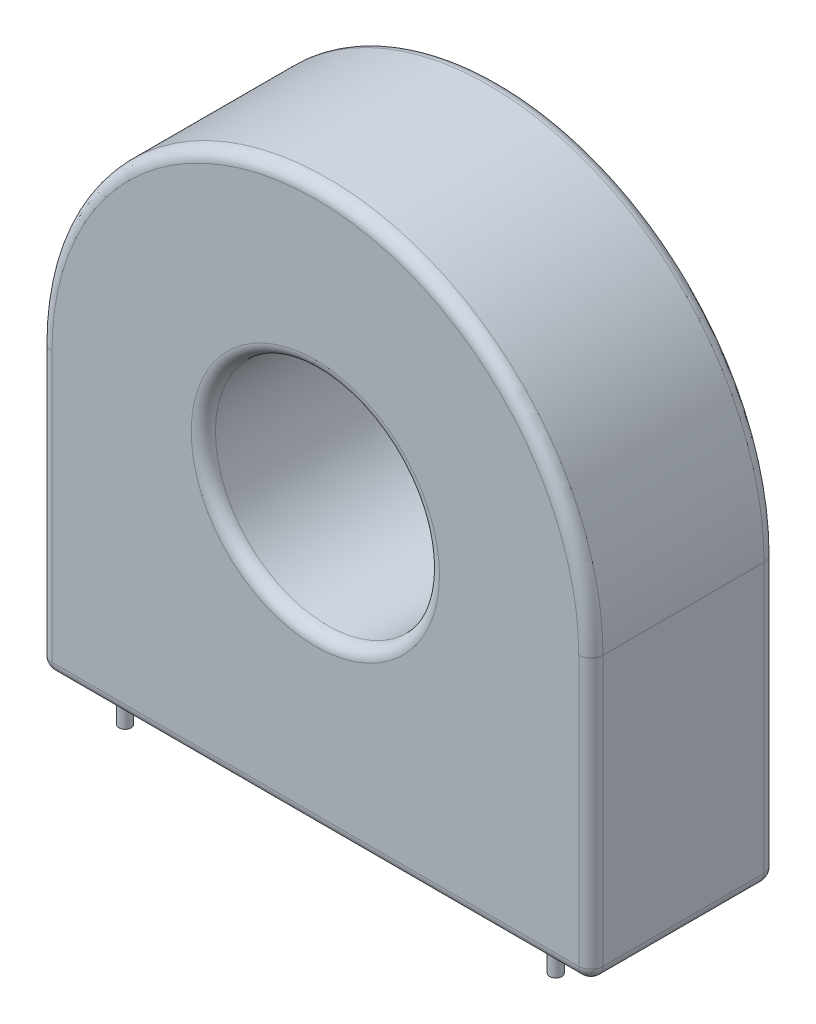
from build123d import *

# Parameters (mm, degrees)
SKETCH1_R           = 9.25
BOSS_EXTRUDE1_DEPTH = 7.65
SKETCH2_R           = 0.5
BOSS_EXTRUDE2_DEPTH = 2.5
FILLET1_R           = 1
SKETCH3_W           = 0.895944424
SKETCH3_H           = 4
SKETCH3_W_2         = 1.965215774
SKETCH3_H_2         = 0.500882695
CUT_EXTRUDE1_DEPTH  = 0.01
SKETCH4_W           = 0.682539037
SKETCH4_H           = 0.809522518
SKETCH4_H_2         = 0.809522517
CUT_EXTRUDE2_DEPTH  = 0.01


with BuildPart() as part:
    # Sketch1 → Boss-Extrude1 (new, symmetric)
    with BuildSketch(Plane.XY):
        with BuildLine():
            Line((-22.75, 11.625), (-22.75, -11.625))
            Line((-22.75, -11.625), (22.75, -11.625))
            Line((22.75, -11.625), (22.75, 11.625))
            ThreePointArc((22.75, 11.625), (0, 34.375), (-22.75, 11.625))
        make_face()
        with Locations((0, 11.625)):
            Circle(SKETCH1_R, mode=Mode.SUBTRACT)
    extrude(amount=BOSS_EXTRUDE1_DEPTH, both=True)

    # Sketch2 → Boss-Extrude2 (add, symmetric)
    with BuildSketch(Plane.XZ.offset(11.625)):
        with Locations((17.78, 5.58)):
            Circle(SKETCH2_R)
        with Locations((0, -4.58)):
            Circle(SKETCH2_R)
        with Locations((-17.78, 5.58)):
            Circle(SKETCH2_R)
    extrude(amount=BOSS_EXTRUDE2_DEPTH, both=True)

    # Fillet1
    fillet1_edges = [part.edges().sort_by_distance(p)[0] for p in [
        (-22.75, 0, -7.65),
        (0, 34.375, -7.65),
        (22.75, 0, 7.65),
        (-22.75, 0, 7.65),
        (-22.75, -11.625, 0),
        (22.75, -11.625, 0),
        (0, -11.625, -7.65),
        (0, -11.625, 7.65),
        (22.75, 0, -7.65),
        (0, 34.375, 7.65),
        (-9.25, 11.625, 7.65),
    ]]
    fillet(fillet1_edges, radius=FILLET1_R)

    # Sketch3 → Cut-Extrude1 (cut)
    # profile 1 of 17: a face of its own
    with BuildSketch(Plane.XY.offset(-7.65)):
        Polygon((-8.243385382, -3.852442817), (-9.139329806, -3.852442817), (-9.139329806, -0.943216627), (-11.623966601, -3.852442817), (-12.582009721, -3.852442817), (-12.582009721, 0.147557183), (-11.686065297, 0.147557183), (-11.686065297, -2.761482996), (-9.201445726, 0.147557183), (-8.243385382, 0.147557183), align=None)
    # profile 2 of 17: a face of its own
    with BuildSketch(Plane.XY.offset(-7.65)):
        with Locations((-7.393297629, -1.852442817)):
            Rectangle(SKETCH3_W, SKETCH3_H)
    # profile 3 of 17: a face of its own
    with BuildSketch(Plane.XY.offset(-7.65)):
        Polygon((-2.768958574, -3.852441956), (-6.834476962, -3.852441956), (-6.834476962, -3.351560122), (-3.664902998, -3.351560122), (-3.664902998, 0.147557183), (-2.768958574, 0.147557183), align=None)
    # profile 4 of 17: a face of its own
    with BuildSketch(Plane.XY.offset(-7.65)):
        with Locations((-0.282186518, -1.852442817)):
            Rectangle(SKETCH3_W, SKETCH3_H)
    # profile 5 of 17: a face of its own
    with BuildSketch(Plane.XY.offset(-7.65)):
        Polygon((5.244161293, -3.852442817), (4.329861111, -3.852442817), (3.769090333, -2.723695022), (1.66010458, -2.723695022), (1.099333802, -3.852442817), (0.18503362, -3.852442817), (2.19649402, 0.147557183), (3.232700893, 0.147557183), align=None)
        Polygon((3.506990947, -2.222812327), (2.714597456, -0.642503409), (1.922203965, -2.222812327), align=None, mode=Mode.SUBTRACT)
    # profile 6 of 17: a face of its own
    with BuildSketch(Plane.XY.offset(-7.65)):
        Polygon((9.590829785, -3.852442817), (8.694885362, -3.852442817), (8.694885362, -1.877134176), (6.14814987, -1.877134176), (6.14814987, -3.852442817), (5.252205447, -3.852442817), (5.252205447, 0.147557183), (6.14814987, 0.147557183), (6.14814987, -1.37625148), (8.694885362, -1.37625148), (8.694885362, 0.147557183), (9.590829785, 0.147557183), align=None)
    # profile 7 of 17: a face of its own
    with BuildSketch(Plane.XY.offset(-7.65)):
        Polygon((14.532518498, -0.353325513), (12.582011443, -0.353325513), (12.582011443, -3.852442817), (11.686067881, -3.852442817), (11.686067881, -0.353325513), (9.735560826, -0.353325513), (9.735560826, 0.147557183), (14.532518498, 0.147557183), align=None)
    # profile 8 of 17: a face of its own
    with BuildSketch(Plane.XY.offset(-7.65)):
        with BuildLine():
            add(Edge.make_bspline(
                [(-14.092768959, -8.387409611), (-14.093682359, -8.416798847), (-14.095444674, -8.473502486), (-14.107040039, -8.555298605), (-14.125683506, -8.631229451), (-14.151024529, -8.701754478), (-14.183558361, -8.767078187), (-14.224942542, -8.825300742), (-14.271907298, -8.879214637), (-14.326767489, -8.926585214), (-14.38808482, -8.967933996), (-14.454750326, -9.004373318), (-14.52729125, -9.03541708), (-14.606060265, -9.059642085), (-14.69033939, -9.079109265), (-14.780196049, -9.093183874), (-14.875991171, -9.100984664), (-14.941667322, -9.101946627), (-14.975485009, -9.102441956)],
                knots=[0, 0, 0, 0, 1.091324182, 2.105602559, 3.061388645, 3.990302777, 4.883708783, 5.761913066, 6.63583257, 7.533363956, 8.444729669, 9.377803759, 10.351071984, 11.369571165, 12.434066396, 13.5611468, 14.744196001, 16, 16, 16, 16], degree=3))
            Line((-14.975485009, -9.102441956), (-16.973509493, -9.102441956))
            add(Edge.make_bspline(
                [(-16.973509493, -9.102441956), (-17.007103675, -9.101941333), (-17.072556098, -9.100965956), (-17.168128459, -9.093184015), (-17.25798513, -9.079109231), (-17.342264241, -9.05964209), (-17.421033297, -9.03541709), (-17.493574078, -9.004373278), (-17.560240087, -8.96793414), (-17.621555608, -8.926584691), (-17.676422367, -8.879216537), (-17.723363266, -8.825293838), (-17.76483693, -8.767104304), (-17.797071266, -8.701561929), (-17.823788355, -8.631435435), (-17.842083583, -8.555267841), (-17.853747393, -8.473757651), (-17.855521593, -8.417298834), (-17.85643739, -8.388156242)],
                knots=[0, 0, 0, 0, 1.248585623, 2.432652029, 3.560701514, 4.626112014, 5.645486916, 6.619591972, 7.553468334, 8.465617653, 9.36392075, 10.238591664, 11.11755104, 12.011725211, 12.945218025, 13.90182591, 14.916976379, 16, 16, 16, 16], degree=3))
            Line((-17.85643739, -8.388156242), (-17.856440834, -5.817603477))
            add(Edge.make_bspline(
                [(-17.856440834, -5.817603477), (-17.855523491, -5.788462915), (-17.853746238, -5.732006206), (-17.842083798, -5.650497895), (-17.8237883, -5.574330315), (-17.797071279, -5.504203818), (-17.764836926, -5.438661443), (-17.723363267, -5.380471908), (-17.676422367, -5.32654921), (-17.621555608, -5.279181056), (-17.560240087, -5.237831606), (-17.493574078, -5.201392469), (-17.421033297, -5.170348655), (-17.342264241, -5.146123665), (-17.257985128, -5.126656481), (-17.168128465, -5.112581873), (-17.072333344, -5.104781083), (-17.006657193, -5.10381912), (-16.972839506, -5.103323791)],
                knots=[0, 0, 0, 0, 1.082394717, 2.097023559, 3.053139899, 3.986153045, 4.879867752, 5.758375482, 6.632596953, 7.530438465, 8.442119083, 9.37551558, 10.3491201, 11.367971205, 12.432834253, 13.560304098, 14.743762081, 16, 16, 16, 16], degree=3))
            Line((-16.972839506, -5.103323791), (-14.975689966, -5.102442817))
            add(Edge.make_bspline(
                [(-14.975689966, -5.102442817), (-14.941806362, -5.10331105), (-14.876074911, -5.104995352), (-14.780194387, -5.11252725), (-14.690339799, -5.126669955), (-14.606060162, -5.146120303), (-14.527291275, -5.170349507), (-14.45475032, -5.201392218), (-14.388084821, -5.237831805), (-14.326767488, -5.279180519), (-14.271907299, -5.326551114), (-14.22494254, -5.380465004), (-14.183558371, -5.43868756), (-14.151024493, -5.504011269), (-14.12568365, -5.574536294), (-14.107039472, -5.65046715), (-14.095481961, -5.73201659), (-14.093692588, -5.788469804), (-14.092768959, -5.817609505)],
                knots=[0, 0, 0, 0, 1.259172173, 2.442692089, 3.570220939, 4.635139714, 5.654044138, 6.627699609, 7.561144954, 8.472873283, 9.370761781, 10.245029003, 11.123582708, 12.017344185, 12.946627916, 13.902794293, 14.917476233, 16, 16, 16, 16], degree=3))
            Line((-14.092768959, -5.817609505), (-14.092768959, -8.387409611))
        make_face()
        with BuildLine():
            Line((-14.921694844, -8.418002541), (-14.921694844, -5.787010546))
            add(Edge.make_bspline(
                [(-14.921694844, -5.787010546), (-14.922552419, -5.772712006), (-14.924186458, -5.745467314), (-14.936173859, -5.707682312), (-14.953640843, -5.675085245), (-14.978500578, -5.648802462), (-15.009079361, -5.628002708), (-15.046310566, -5.614310691), (-15.089384151, -5.605145539), (-15.120343035, -5.604532632), (-15.13686067, -5.604205625)],
                knots=[0, 0, 0, 0, 1.068687892, 2.03629688, 2.942648866, 3.814683618, 4.718091592, 5.68670121, 6.765775135, 8, 8, 8, 8], degree=3))
            Line((-15.13686067, -5.604205625), (-16.811524126, -5.603325513))
            add(Edge.make_bspline(
                [(-16.811524126, -5.603325513), (-16.82802163, -5.604015565), (-16.858944314, -5.60530899), (-16.902236935, -5.614455591), (-16.939920748, -5.627778683), (-16.970720504, -5.648813863), (-16.995487187, -5.675102237), (-17.013313351, -5.707522083), (-17.023699745, -5.7458961), (-17.02619132, -5.773161473), (-17.027513228, -5.787627142)],
                knots=[0, 0, 0, 0, 1.229193561, 2.303982665, 3.289199236, 4.189019928, 5.057591977, 5.960344992, 6.917859159, 8, 8, 8, 8], degree=3))
            Line((-17.027513228, -5.787627142), (-17.02751495, -8.418002541))
            add(Edge.make_bspline(
                [(-17.02751495, -8.418002541), (-17.02619583, -8.432514035), (-17.023713126, -8.459826005), (-17.01331298, -8.498243414), (-16.995487323, -8.530664262), (-16.970720311, -8.556949177), (-16.939921439, -8.577998001), (-16.902234004, -8.591263307), (-16.858955334, -8.600660893), (-16.827986688, -8.60124727), (-16.811463845, -8.601560122)],
                knots=[0, 0, 0, 0, 1.085029602, 2.042125889, 2.944484921, 3.812677906, 4.712105896, 5.696892497, 6.771212539, 8, 8, 8, 8], degree=3))
            Line((-16.811463845, -8.601560122), (-15.137675333, -8.601560122))
            add(Edge.make_bspline(
                [(-15.137675333, -8.601560122), (-15.120884586, -8.601250355), (-15.089651388, -8.600674144), (-15.046310398, -8.591455672), (-15.009079392, -8.577762891), (-14.978500598, -8.55696333), (-14.953640732, -8.530680458), (-14.936174313, -8.498083577), (-14.924122164, -8.460101229), (-14.922532857, -8.432645352), (-14.921694844, -8.418002541)],
                knots=[0, 0, 0, 0, 1.248967675, 2.323258931, 3.287575479, 4.186979369, 5.05514909, 5.957483945, 6.920804297, 8, 8, 8, 8], degree=3))
        make_face(mode=Mode.SUBTRACT)
    # profile 9 of 17: a face of its own
    with BuildSketch(Plane.XY.offset(-7.65)):
        with BuildLine():
            add(Edge.make_bspline(
                [(-10.091358025, -8.387409611), (-10.092271424, -8.416798847), (-10.094033739, -8.473502486), (-10.105629104, -8.555298605), (-10.124272571, -8.631229451), (-10.149613594, -8.701754478), (-10.182147427, -8.767078187), (-10.223531608, -8.825300742), (-10.270496363, -8.879214637), (-10.325356554, -8.926585214), (-10.386673885, -8.967933996), (-10.453339391, -9.004373318), (-10.525880315, -9.03541708), (-10.60464933, -9.059642085), (-10.688928455, -9.079109265), (-10.778785114, -9.093183874), (-10.874580236, -9.100984664), (-10.940256387, -9.101946627), (-10.974074074, -9.102441956)],
                knots=[0, 0, 0, 0, 1.091324182, 2.105602559, 3.061388645, 3.990302777, 4.883708783, 5.761913066, 6.63583257, 7.533363956, 8.444729669, 9.377803759, 10.351071984, 11.369571165, 12.434066396, 13.5611468, 14.744196001, 16, 16, 16, 16], degree=3))
            Line((-10.974074074, -9.102441956), (-12.972098559, -9.102441956))
            add(Edge.make_bspline(
                [(-12.972098559, -9.102441956), (-13.00569274, -9.101941333), (-13.071145163, -9.100965956), (-13.166717524, -9.093184015), (-13.256574195, -9.079109231), (-13.340853306, -9.05964209), (-13.419622363, -9.03541709), (-13.492163143, -9.004373278), (-13.558829153, -8.96793414), (-13.620144673, -8.926584691), (-13.675011432, -8.879216537), (-13.721952331, -8.825293838), (-13.763425995, -8.767104304), (-13.795660331, -8.701561929), (-13.82237742, -8.631435435), (-13.840672649, -8.555267841), (-13.852336458, -8.473757651), (-13.854110658, -8.417298834), (-13.855026455, -8.388156242)],
                knots=[0, 0, 0, 0, 1.248585623, 2.432652029, 3.560701514, 4.626112014, 5.645486916, 6.619591972, 7.553468334, 8.465617653, 9.36392075, 10.238591664, 11.11755104, 12.011725211, 12.945218025, 13.90182591, 14.916976379, 16, 16, 16, 16], degree=3))
            Line((-13.855026455, -8.388156242), (-13.8550299, -5.817603477))
            add(Edge.make_bspline(
                [(-13.8550299, -5.817603477), (-13.854112557, -5.788462915), (-13.852335303, -5.732006206), (-13.840672863, -5.650497895), (-13.822377366, -5.574330315), (-13.795660345, -5.504203818), (-13.763425991, -5.438661443), (-13.721952332, -5.380471908), (-13.675011432, -5.32654921), (-13.620144673, -5.279181056), (-13.558829153, -5.237831606), (-13.492163143, -5.201392469), (-13.419622363, -5.170348655), (-13.340853307, -5.146123665), (-13.256574193, -5.126656481), (-13.16671753, -5.112581873), (-13.070922409, -5.104781083), (-13.005246258, -5.10381912), (-12.971428571, -5.103323791)],
                knots=[0, 0, 0, 0, 1.082394717, 2.097023559, 3.053139899, 3.986153045, 4.879867752, 5.758375482, 6.632596953, 7.530438465, 8.442119083, 9.37551558, 10.3491201, 11.367971205, 12.432834253, 13.560304098, 14.743762081, 16, 16, 16, 16], degree=3))
            Line((-12.971428571, -5.103323791), (-10.974279032, -5.102442817))
            add(Edge.make_bspline(
                [(-10.974279032, -5.102442817), (-10.940395427, -5.10331105), (-10.874663976, -5.104995352), (-10.778783452, -5.11252725), (-10.688928865, -5.126669955), (-10.604649228, -5.146120303), (-10.52588034, -5.170349507), (-10.453339385, -5.201392218), (-10.386673887, -5.237831805), (-10.325356553, -5.279180519), (-10.270496364, -5.326551114), (-10.223531605, -5.380465004), (-10.182147436, -5.43868756), (-10.149613558, -5.504011269), (-10.124272715, -5.574536294), (-10.105628537, -5.65046715), (-10.094071026, -5.73201659), (-10.092281653, -5.788469804), (-10.091358025, -5.817609505)],
                knots=[0, 0, 0, 0, 1.259172173, 2.442692089, 3.570220939, 4.635139714, 5.654044138, 6.627699609, 7.561144954, 8.472873283, 9.370761781, 10.245029003, 11.123582708, 12.017344185, 12.946627916, 13.902794293, 14.917476233, 16, 16, 16, 16], degree=3))
            Line((-10.091358025, -5.817609505), (-10.091358025, -8.387409611))
        make_face()
        with BuildLine():
            Line((-10.920283909, -8.418002541), (-10.920283909, -5.787010546))
            add(Edge.make_bspline(
                [(-10.920283909, -5.787010546), (-10.921141484, -5.772712006), (-10.922775523, -5.745467314), (-10.934762925, -5.707682312), (-10.952229908, -5.675085245), (-10.977089643, -5.648802462), (-11.007668426, -5.628002708), (-11.044899632, -5.614310691), (-11.087973216, -5.605145539), (-11.1189321, -5.604532632), (-11.135449735, -5.604205625)],
                knots=[0, 0, 0, 0, 1.068687892, 2.03629688, 2.942648866, 3.814683618, 4.718091592, 5.68670121, 6.765775135, 8, 8, 8, 8], degree=3))
            Line((-11.135449735, -5.604205625), (-12.810113192, -5.603325513))
            add(Edge.make_bspline(
                [(-12.810113192, -5.603325513), (-12.826610696, -5.604015565), (-12.857533379, -5.60530899), (-12.900826, -5.614455591), (-12.938509813, -5.627778683), (-12.969309569, -5.648813863), (-12.994076253, -5.675102237), (-13.011902417, -5.707522083), (-13.02228881, -5.7458961), (-13.024780385, -5.773161473), (-13.026102293, -5.787627142)],
                knots=[0, 0, 0, 0, 1.229193561, 2.303982665, 3.289199236, 4.189019928, 5.057591977, 5.960344992, 6.917859159, 8, 8, 8, 8], degree=3))
            Line((-13.026102293, -5.787627142), (-13.026104015, -8.418002541))
            add(Edge.make_bspline(
                [(-13.026104015, -8.418002541), (-13.024784896, -8.432514035), (-13.022302191, -8.459826005), (-13.011902045, -8.498243414), (-12.994076389, -8.530664262), (-12.969309376, -8.556949177), (-12.938510504, -8.577998001), (-12.900823069, -8.591263307), (-12.857544399, -8.600660893), (-12.826575753, -8.60124727), (-12.81005291, -8.601560122)],
                knots=[0, 0, 0, 0, 1.085029602, 2.042125889, 2.944484921, 3.812677906, 4.712105896, 5.696892497, 6.771212539, 8, 8, 8, 8], degree=3))
            Line((-12.81005291, -8.601560122), (-11.136264399, -8.601560122))
            add(Edge.make_bspline(
                [(-11.136264399, -8.601560122), (-11.119473651, -8.601250355), (-11.088240453, -8.600674144), (-11.044899463, -8.591455672), (-11.007668457, -8.577762891), (-10.977089664, -8.55696333), (-10.952229797, -8.530680458), (-10.934763379, -8.498083577), (-10.922711229, -8.460101229), (-10.921121922, -8.432645352), (-10.920283909, -8.418002541)],
                knots=[0, 0, 0, 0, 1.248967675, 2.323258931, 3.287575479, 4.186979369, 5.05514909, 5.957483945, 6.920804297, 8, 8, 8, 8], degree=3))
        make_face(mode=Mode.SUBTRACT)
    # profile 10 of 17: a face of its own
    with BuildSketch(Plane.XY.offset(-7.65)):
        Polygon((-6.747720493, -5.603325513), (-7.839507034, -5.603325513), (-7.839507034, -9.102442817), (-8.668432919, -9.102442817), (-8.668432919, -5.102442817), (-6.747720493, -5.102442817), align=None)
    # profile 11 of 17: a face of its own
    with BuildSketch(Plane.XY.offset(-7.65)):
        with Locations((-4.929806858, -7.441066726)):
            Rectangle(SKETCH3_W_2, SKETCH3_H_2)
    # profile 12 of 17: a face of its own
    with BuildSketch(Plane.XY.offset(-7.65)):
        with BuildLine():
            Line((-0.062433862, -9.102441956), (-2.943174396, -9.102441956))
            add(Edge.make_bspline(
                [(-2.943174396, -9.102441956), (-2.976768578, -9.101941333), (-3.042221001, -9.100965956), (-3.13779336, -9.093184015), (-3.227650038, -9.079109233), (-3.311929126, -9.059642082), (-3.390698265, -9.03541712), (-3.463238756, -9.004373172), (-3.529905784, -8.967934513), (-3.59121764, -8.926583343), (-3.646097698, -8.879221432), (-3.692990291, -8.825276058), (-3.734798666, -8.766957424), (-3.766268277, -8.701062772), (-3.793842135, -8.630980299), (-3.811573222, -8.554628837), (-3.823449348, -8.472886893), (-3.82519911, -8.416420771), (-3.826102293, -8.387274408)],
                knots=[0, 0, 0, 0, 1.247794276, 2.431110226, 3.558444758, 4.623180007, 5.641908834, 6.615396507, 7.548680983, 8.460252186, 9.357985943, 10.232102494, 11.11050479, 12.013864952, 12.936550513, 13.903155723, 14.917662794, 16, 16, 16, 16], degree=3))
            Line((-3.826102293, -8.387274408), (-3.826105737, -7.342130352))
            add(Edge.make_bspline(
                [(-3.826105737, -7.342130352), (-3.825194362, -7.313042769), (-3.823427062, -7.25663736), (-3.811620081, -7.174927589), (-3.793616474, -7.098392458), (-3.76672072, -7.028017), (-3.734505794, -6.962470097), (-3.693027214, -6.904281387), (-3.646087186, -6.850359776), (-3.59122188, -6.802986296), (-3.529899461, -6.76165761), (-3.463260618, -6.725137721), (-3.390529258, -6.694379354), (-3.31210164, -6.668858204), (-3.227716144, -6.649313706), (-3.137655444, -6.636986831), (-3.042063706, -6.627305701), (-2.976335586, -6.626609714), (-2.942504409, -6.62625148)],
                knots=[0, 0, 0, 0, 1.079603584, 2.093521595, 3.059565557, 3.99192505, 4.885013636, 5.762905899, 6.636514906, 7.533727405, 8.444769315, 9.377511891, 10.350434321, 11.371899559, 12.436016582, 13.561057118, 14.74464218, 16, 16, 16, 16], degree=3))
            Line((-2.942504409, -6.62625148), (-0.891359747, -6.62625148))
            Line((-0.891359747, -6.62625148), (-0.891359747, -5.603325513))
            Line((-0.891359747, -5.603325513), (-3.605051257, -5.603325513))
            Line((-3.605051257, -5.603325513), (-3.605051257, -5.102442817))
            Line((-3.605051257, -5.102442817), (-0.062433862, -5.102442817))
            Line((-0.062433862, -5.102442817), (-0.062433862, -7.127134176))
            Line((-0.062433862, -7.127134176), (-2.781189029, -7.127134176))
            add(Edge.make_bspline(
                [(-2.781189029, -7.127134176), (-2.797679997, -7.127833524), (-2.82859041, -7.129144371), (-2.871963862, -7.138180282), (-2.909228473, -7.151811502), (-2.940980804, -7.171619732), (-2.964826556, -7.198943809), (-2.983041164, -7.231267482), (-2.993346074, -7.269724557), (-2.995849785, -7.29697756), (-2.997178131, -7.311436665)],
                knots=[0, 0, 0, 0, 1.228569347, 2.302811313, 3.287526345, 4.174798407, 5.059089855, 5.961383309, 6.918410039, 8, 8, 8, 8], degree=3))
            Line((-2.997178131, -7.311436665), (-2.997179853, -8.417253326))
            add(Edge.make_bspline(
                [(-2.997179853, -8.417253326), (-2.995852085, -8.431715422), (-2.993349562, -8.458972994), (-2.983029314, -8.497407893), (-2.964868248, -8.529812795), (-2.940719274, -8.556964482), (-2.909540764, -8.577956677), (-2.871912747, -8.591275855), (-2.828616048, -8.600657094), (-2.797650133, -8.601245948), (-2.781128748, -8.601560122)],
                knots=[0, 0, 0, 0, 1.080018298, 2.035574722, 2.936481959, 3.819414846, 4.717395756, 5.700597943, 6.773189523, 8, 8, 8, 8], degree=3))
            Line((-2.781128748, -8.601560122), (-0.062433862, -8.601560122))
            Line((-0.062433862, -8.601560122), (-0.062433862, -9.102441956))
        make_face()
    # profile 13 of 17: a face of its own
    with BuildSketch(Plane.XY.offset(-7.65)):
        with Locations((1.09770637, -7.441066726)):
            Rectangle(SKETCH3_W_2, SKETCH3_H_2)
    # profile 14 of 17: a face of its own
    with BuildSketch(Plane.XY.offset(-7.65)):
        with BuildLine():
            add(Edge.make_bspline(
                [(5.965079365, -8.386535527), (5.964178551, -8.415925924), (5.962440446, -8.4726342), (5.95063423, -8.554660449), (5.932548182, -8.630769718), (5.906361096, -8.701259807), (5.874585792, -8.766930613), (5.832868082, -8.825283111), (5.785951405, -8.87921949), (5.731077978, -8.926583878), (5.669764295, -8.967934365), (5.603097775, -9.004373214), (5.530557139, -9.03541711), (5.451788042, -9.059642076), (5.36750894, -9.079109267), (5.277652274, -9.093183873), (5.181857154, -9.100984664), (5.116181002, -9.101946627), (5.082363316, -9.102441956)],
                knots=[0, 0, 0, 0, 1.090546724, 2.104191533, 3.069975193, 3.988060192, 4.890652559, 5.768308273, 6.641681885, 7.538652629, 8.449449058, 9.381940305, 10.354600579, 11.372463556, 12.436293852, 13.562670226, 14.744980438, 16, 16, 16, 16], degree=3))
            Line((5.082363316, -9.102441956), (3.084338831, -9.102441956))
            add(Edge.make_bspline(
                [(3.084338831, -9.102441956), (3.050744649, -9.101941333), (2.985292226, -9.100965956), (2.889719867, -9.093184015), (2.79986319, -9.079109233), (2.715584102, -9.059642082), (2.636814963, -9.03541712), (2.564274471, -9.004373172), (2.497607443, -8.967934513), (2.436295588, -8.926583343), (2.38141553, -8.879221432), (2.334522937, -8.825276058), (2.292714561, -8.766957424), (2.261244951, -8.701062772), (2.233671092, -8.630980299), (2.215940006, -8.554628837), (2.204063879, -8.472886893), (2.202314117, -8.416420771), (2.201410935, -8.387274408)],
                knots=[0, 0, 0, 0, 1.247794276, 2.431110226, 3.558444758, 4.623180007, 5.641908834, 6.615396507, 7.548680983, 8.460252186, 9.357985943, 10.232102494, 11.11050479, 12.013864952, 12.936550513, 13.903155723, 14.917662794, 16, 16, 16, 16], degree=3))
            Line((2.201410935, -8.387274408), (2.20140749, -7.342130352))
            add(Edge.make_bspline(
                [(2.20140749, -7.342130352), (2.202318865, -7.313042769), (2.204086166, -7.25663736), (2.215893147, -7.174927589), (2.233896753, -7.098392458), (2.260792507, -7.028017), (2.293007433, -6.962470097), (2.334486014, -6.904281387), (2.381426042, -6.850359776), (2.436291347, -6.802986296), (2.497613766, -6.76165761), (2.564252609, -6.725137721), (2.636983969, -6.694379354), (2.715411588, -6.668858204), (2.799797083, -6.649313706), (2.889857784, -6.636986831), (2.985449521, -6.627305701), (3.051177641, -6.626609714), (3.085008818, -6.62625148)],
                knots=[0, 0, 0, 0, 1.079603584, 2.093521595, 3.059565557, 3.99192505, 4.885013636, 5.762905899, 6.636514906, 7.533727405, 8.444769315, 9.377511891, 10.350434321, 11.371899559, 12.436016582, 13.561057118, 14.74464218, 16, 16, 16, 16], degree=3))
            Line((3.085008818, -6.62625148), (5.13615348, -6.62625148))
            Line((5.13615348, -6.62625148), (5.13615348, -6.037295593))
            add(Edge.make_bspline(
                [(5.13615348, -6.037295593), (5.134669543, -6.003911441), (5.131863069, -5.940774166), (5.109887248, -5.851914284), (5.071662187, -5.775539215), (5.016131625, -5.713430919), (4.945922492, -5.664285665), (4.860067415, -5.630843446), (4.760163091, -5.608269116), (4.688325623, -5.60561293), (4.65026455, -5.604205625)],
                knots=[0, 0, 0, 0, 1.078341341, 2.039396853, 2.936100315, 3.811247336, 4.704924793, 5.680758394, 6.771214737, 8, 8, 8, 8], degree=3))
            Line((4.65026455, -5.604205625), (2.477723008, -5.603325513))
            Line((2.477723008, -5.603325513), (2.477723008, -5.102442817))
            Line((2.477723008, -5.102442817), (4.866177869, -5.102442817))
            add(Edge.make_bspline(
                [(4.866177869, -5.102442817), (4.908269619, -5.103563399), (4.990162799, -5.105743589), (5.109341208, -5.114696909), (5.221051232, -5.132427713), (5.325501701, -5.157485777), (5.423722659, -5.187375359), (5.513734389, -5.226680498), (5.597083234, -5.271836678), (5.672845167, -5.32471404), (5.741022297, -5.384413088), (5.800067642, -5.451821757), (5.851043602, -5.526016104), (5.890766339, -5.608882975), (5.924528279, -5.697668163), (5.946261716, -5.794495207), (5.962237991, -5.897924134), (5.964114467, -5.969511356), (5.965079365, -6.006322027)],
                knots=[0, 0, 0, 0, 1.248360097, 2.428793654, 3.540639795, 4.597573295, 5.611896563, 6.58001487, 7.504387576, 8.418265567, 9.313545441, 10.184224061, 11.068921664, 11.973149494, 12.902398245, 13.878991678, 14.90936207, 16, 16, 16, 16], degree=3))
            Line((5.965079365, -6.006322027), (5.965079365, -8.386535527))
        make_face()
        with BuildLine():
            Line((5.13615348, -8.417253326), (5.13615348, -7.127134176))
            Line((5.13615348, -7.127134176), (3.246324198, -7.127134176))
            add(Edge.make_bspline(
                [(3.246324198, -7.127134176), (3.229833231, -7.127833524), (3.198922817, -7.129144371), (3.155549365, -7.138180282), (3.118284754, -7.151811502), (3.086532423, -7.171619732), (3.062686671, -7.198943809), (3.044472063, -7.231267482), (3.034167153, -7.269724557), (3.031663443, -7.29697756), (3.030335097, -7.311436665)],
                knots=[0, 0, 0, 0, 1.228569347, 2.302811313, 3.287526345, 4.174798407, 5.059089855, 5.961383309, 6.918410039, 8, 8, 8, 8], degree=3))
            Line((3.030335097, -7.311436665), (3.030333375, -8.417253326))
            add(Edge.make_bspline(
                [(3.030333375, -8.417253326), (3.031661142, -8.431715422), (3.034163665, -8.458972994), (3.044483913, -8.497407893), (3.062644979, -8.529812795), (3.086793953, -8.556964482), (3.117972463, -8.577956677), (3.155600481, -8.591275855), (3.19889718, -8.600657094), (3.229863094, -8.601245948), (3.24638448, -8.601560122)],
                knots=[0, 0, 0, 0, 1.080018298, 2.035574722, 2.936481959, 3.819414846, 4.717395756, 5.700597943, 6.773189523, 8, 8, 8, 8], degree=3))
            Line((3.24638448, -8.601560122), (4.920172991, -8.601560122))
            add(Edge.make_bspline(
                [(4.920172991, -8.601560122), (4.936962248, -8.601249004), (4.968192673, -8.600670281), (5.011551634, -8.591468092), (5.048724441, -8.577722577), (5.079681832, -8.556979089), (5.103925391, -8.529829418), (5.12172559, -8.497248415), (5.133711047, -8.459205719), (5.135310243, -8.431758791), (5.13615348, -8.417253326)],
                knots=[0, 0, 0, 0, 1.246449489, 2.318574743, 3.280947022, 4.178537522, 5.061086541, 5.961602094, 6.922980187, 8, 8, 8, 8], degree=3))
        make_face(mode=Mode.SUBTRACT)
    # profile 15 of 17: a face of its own
    with BuildSketch(Plane.XY.offset(-7.65)):
        Polygon((9.988555101, -5.603325513), (7.149910094, -5.603325513), (9.060536541, -9.102442817), (8.132517981, -9.102442817), (6.253964809, -5.603325513), (6.253964809, -5.102442817), (9.988555101, -5.102442817), align=None)
    # profile 16 of 17: a face of its own
    with BuildSketch(Plane.XY.offset(-7.65)):
        Polygon((13.685714286, -9.102441956), (10.018143395, -9.102441956), (10.018143395, -8.601560122), (12.856788401, -8.601560122), (12.856788401, -5.102442817), (13.685714286, -5.102442817), align=None)
    # profile 17 of 17: a face of its own
    with BuildSketch(Plane.XY.offset(-7.65)):
        Polygon((18.07948547, -5.603325513), (16.332627005, -5.603325513), (16.332627005, -9.102442817), (15.50370112, -9.102442817), (15.50370112, -5.603325513), (13.756842655, -5.603325513), (13.756842655, -5.102442817), (18.07948547, -5.102442817), align=None)
    extrude(amount=CUT_EXTRUDE1_DEPTH, mode=Mode.SUBTRACT)

    # Sketch4 → Cut-Extrude2 (cut)
    # profile 1 of 6: a face of its own
    with BuildSketch(Plane.XZ.offset(11.625)):
        with BuildLine():
            Line((-17.977955234, 3.785665694), (-20.470002579, 3.785665694))
            Line((-20.470002579, 3.785665694), (-20.470002579, 3.410004318))
            Line((-20.470002579, 3.410004318), (-18.522911986, 3.410004318))
            Line((-18.522911986, 3.410004318), (-18.522911986, 2.442393641))
            add(Edge.make_bspline(
                [(-18.522911986, 2.442393641), (-18.523662632, 2.431330693), (-18.525062188, 2.410704172), (-18.532348559, 2.381898417), (-18.544234787, 2.357674062), (-18.560672003, 2.337919704), (-18.581005577, 2.322030697), (-18.606201681, 2.311858475), (-18.635197547, 2.304890863), (-18.656028186, 2.304429461), (-18.667100277, 2.304184213)],
                knots=[0, 0, 0, 0, 1.168383886, 2.178415151, 3.114761772, 3.990479347, 4.869897153, 5.80768764, 6.834722204, 8, 8, 8, 8], degree=3))
            Line((-18.667100277, 2.304184213), (-19.888988582, 2.304184858))
            add(Edge.make_bspline(
                [(-19.888988582, 2.304184858), (-19.911388772, 2.303913138), (-19.954860271, 2.303385817), (-20.017868855, 2.296194587), (-20.077248979, 2.286727695), (-20.132730361, 2.272402718), (-20.18416234, 2.252852298), (-20.232005362, 2.229664337), (-20.276380349, 2.20280682), (-20.316615169, 2.171332708), (-20.352362455, 2.135567208), (-20.38379617, 2.095465719), (-20.410571058, 2.050933071), (-20.431212773, 2.001442532), (-20.448927781, 1.948540897), (-20.460190982, 1.890950388), (-20.46870481, 1.829566741), (-20.469567241, 1.787021412), (-20.47001033, 1.765163048)],
                knots=[0, 0, 0, 0, 1.188285322, 2.306076078, 3.362203406, 4.378287727, 5.341092893, 6.277876351, 7.197026917, 8.088882973, 8.98250288, 9.874358936, 10.787456248, 11.730866857, 12.715190664, 13.743331781, 14.840599528, 16, 16, 16, 16], degree=3))
            Line((-20.47001033, 1.765163048), (-20.470002579, 1.32406811))
            add(Edge.make_bspline(
                [(-20.470002579, 1.32406811), (-20.469563353, 1.302195471), (-20.468708707, 1.259635704), (-20.460190504, 1.198238161), (-20.448927902, 1.140647625), (-20.431212736, 1.087746019), (-20.410571093, 1.03825539), (-20.383796072, 0.993723059), (-20.352362807, 0.953620423), (-20.316613856, 0.917859191), (-20.276385305, 0.886369006), (-20.23198608, 0.859573627), (-20.184305432, 0.836179537), (-20.132584144, 0.817582945), (-20.077191415, 0.803328368), (-20.017986612, 0.792551309), (-19.954915294, 0.786777017), (-19.911599716, 0.786043132), (-19.889322499, 0.785665694)],
                knots=[0, 0, 0, 0, 1.160756192, 2.258598661, 3.287278292, 4.272117663, 5.216022406, 6.129597976, 7.021921163, 7.916009126, 8.808332313, 9.727964308, 10.665238429, 11.624484024, 12.641100546, 13.699789761, 14.817001044, 16, 16, 16, 16], degree=3))
            Line((-19.889322499, 0.785665694), (-18.159607485, 0.78566634))
            Line((-18.159607485, 0.78566634), (-18.159607485, 1.161328361))
            Line((-18.159607485, 1.161328361), (-19.78114043, 1.161328361))
            add(Edge.make_bspline(
                [(-19.78114043, 1.161328361), (-19.792329157, 1.16158698), (-19.813268247, 1.16207097), (-19.842601797, 1.168805574), (-19.867455066, 1.179970144), (-19.887971087, 1.195674155), (-19.904367896, 1.215494681), (-19.916406758, 1.239882171), (-19.923409323, 1.268768003), (-19.924909214, 1.289376062), (-19.92569816, 1.300215959)],
                knots=[0, 0, 0, 0, 1.175204619, 2.199330993, 3.14391349, 4.020841102, 4.89407896, 5.827774186, 6.857403133, 8, 8, 8, 8], degree=3))
            Line((-19.92569816, 1.300215959), (-19.925045827, 1.789033285))
            add(Edge.make_bspline(
                [(-19.925045827, 1.789033285), (-19.924544547, 1.79986403), (-19.923589875, 1.820490854), (-19.916203781, 1.849438678), (-19.904578802, 1.874238348), (-19.887949436, 1.894166243), (-19.867461374, 1.909882565), (-19.842599843, 1.921043329), (-19.81339251, 1.927751612), (-19.792580471, 1.928255177), (-19.781518266, 1.928522837)],
                knots=[0, 0, 0, 0, 1.137900938, 2.16709752, 3.121197092, 3.994068258, 4.870627628, 5.814813473, 6.838509792, 8, 8, 8, 8], degree=3))
            Line((-19.781518266, 1.928522837), (-18.55886137, 1.928522837))
            add(Edge.make_bspline(
                [(-18.55886137, 1.928522837), (-18.536729182, 1.928904128), (-18.493558818, 1.929647862), (-18.430631937, 1.935408335), (-18.371427114, 1.946185534), (-18.316034444, 1.960440107), (-18.264312956, 1.979036591), (-18.216633021, 2.002431097), (-18.172231221, 2.029224965), (-18.132011979, 2.060720614), (-18.096228458, 2.096461554), (-18.06504139, 2.13649113), (-18.037839154, 2.180549483), (-18.017584813, 2.229788875), (-17.999551643, 2.282354593), (-17.988520085, 2.339570131), (-17.979863979, 2.400706371), (-17.979035868, 2.443037678), (-17.978608213, 2.464898498)],
                knots=[0, 0, 0, 0, 1.178342751, 2.298439003, 3.359862066, 4.379103791, 5.340826441, 6.280520881, 7.202527636, 8.097155065, 8.993551826, 9.888179255, 10.794055488, 11.740397672, 12.716623759, 13.747959744, 14.836996782, 16, 16, 16, 16], degree=3))
            Line((-17.978608213, 2.464898498), (-17.977955234, 3.785665694))
        make_face()
    # profile 2 of 6: a face of its own
    with BuildSketch(Plane.XZ.offset(11.625)):
        Polygon((-15.272495139, 3.023761578), (-15.781121441, 3.023761578), (-15.781121441, 3.78566634), (-16.241439547, 3.78566634), (-16.241439547, 3.023761578), (-16.923978584, 3.023761578), (-16.923978584, 3.78566634), (-17.384297336, 3.78566634), (-17.384297336, 3.023761578), (-17.892923638, 3.023761578), (-17.892923638, 2.690427599), (-17.384297336, 2.690427599), (-17.384297336, 1.880905081), (-17.892923638, 1.880905081), (-17.892923638, 1.547571102), (-17.384297336, 1.547571102), (-17.384297336, 0.78566634), (-16.923978584, 0.78566634), (-16.923978584, 1.547571102), (-16.241439547, 1.547571102), (-16.241439547, 0.78566634), (-15.781121441, 0.78566634), (-15.781121441, 1.547571102), (-15.272495139, 1.547571102), (-15.272495139, 1.880905081), (-15.781121441, 1.880905081), (-15.781121441, 2.690427599), (-15.272495139, 2.690427599), align=None)
        with Locations((-16.582709066, 2.28566634)):
            Rectangle(SKETCH4_W, SKETCH4_H, mode=Mode.SUBTRACT)
    # profile 3 of 6: a face of its own
    with BuildSketch(Plane.XZ.offset(11.625)):
        Polygon((14.998388573, 1.161328361), (14.27177957, 1.161328361), (14.27177957, 3.78566634), (13.726822818, 3.78566634), (13.726822818, 0.78566634), (14.998388573, 0.78566634), align=None)
    # profile 4 of 6: a face of its own
    with BuildSketch(Plane.XZ.offset(11.625)):
        Polygon((18.162425496, 3.023761578), (17.653799194, 3.023761578), (17.653799194, 3.78566634), (17.193481088, 3.78566634), (17.193481088, 3.023761578), (16.510942051, 3.023761578), (16.510942051, 3.78566634), (16.050623299, 3.78566634), (16.050623299, 3.023761578), (15.541996997, 3.023761578), (15.541996997, 2.690427599), (16.050623299, 2.690427599), (16.050623299, 1.880905081), (15.541996997, 1.880905081), (15.541996997, 1.547571102), (16.050623299, 1.547571102), (16.050623299, 0.78566634), (16.510942051, 0.78566634), (16.510942051, 1.547571102), (17.193481088, 1.547571102), (17.193481088, 0.78566634), (17.653799194, 0.78566634), (17.653799194, 1.547571102), (18.162425496, 1.547571102), (18.162425496, 1.880905081), (17.653799194, 1.880905081), (17.653799194, 2.690427599), (18.162425496, 2.690427599), align=None)
        with Locations((16.852211569, 2.28566634)):
            Rectangle(SKETCH4_W, SKETCH4_H, mode=Mode.SUBTRACT)
    # profile 5 of 6: a face of its own
    with BuildSketch(Plane.XZ.offset(11.625)):
        with BuildLine():
            Line((0.068470519, -0.379493213), (-1.784382439, -0.379493213))
            add(Edge.make_bspline(
                [(-1.784382439, -0.379493213), (-1.806873855, -0.379761618), (-1.85043672, -0.380281483), (-1.913535932, -0.38748279), (-1.972916046, -0.396949737), (-2.02839739, -0.411274726), (-2.079829521, -0.430825053), (-2.127671997, -0.454013362), (-2.172048953, -0.480869618), (-2.212276659, -0.512348289), (-2.248050363, -0.548096859), (-2.279268389, -0.58811271), (-2.306247453, -0.632046778), (-2.32700778, -0.681081577), (-2.34458205, -0.733819548), (-2.355797817, -0.791190557), (-2.364412714, -0.852341249), (-2.365246702, -0.894670495), (-2.365677392, -0.91653025)],
                knots=[0, 0, 0, 0, 1.195173015, 2.314890322, 3.372837922, 4.3906735, 5.355138094, 6.293536131, 7.214270886, 8.107664086, 9.002824179, 9.896217379, 10.800843866, 11.735133181, 12.721153505, 13.751066659, 14.838601261, 16, 16, 16, 16], degree=3))
            Line((-2.365677392, -0.91653025), (-2.365669641, -1.584535169))
            add(Edge.make_bspline(
                [(-2.365669641, -1.584535169), (-2.364187967, -1.617000533), (-2.361398272, -1.678126278), (-2.346527644, -1.764152666), (-2.321824118, -1.838558768), (-2.286798166, -1.901362163), (-2.244270892, -1.952987001), (-2.198476054, -1.997161407), (-2.148578988, -2.033770202), (-2.112016281, -2.051326722), (-2.093851995, -2.060048769)],
                knots=[0, 0, 0, 0, 1.338248567, 2.519652672, 3.585454005, 4.553382934, 5.464210136, 6.331599572, 7.171141735, 8, 8, 8, 8], degree=3))
            add(Edge.make_bspline(
                [(-2.093851995, -2.060048769), (-2.112009075, -2.068778563), (-2.148557278, -2.086350677), (-2.198689738, -2.122930761), (-2.244249093, -2.16783698), (-2.286830318, -2.22007597), (-2.321654842, -2.283389471), (-2.346749032, -2.358318841), (-2.361260678, -2.444872432), (-2.364152293, -2.506422124), (-2.365677392, -2.538884748)],
                knots=[0, 0, 0, 0, 0.824792689, 1.660216872, 2.529624704, 3.443034264, 4.414115552, 5.474689096, 6.668097019, 8, 8, 8, 8], degree=3))
            Line((-2.365677392, -2.538884748), (-2.365669641, -2.841090797))
            add(Edge.make_bspline(
                [(-2.365669641, -2.841090797), (-2.365230415, -2.862963436), (-2.364375769, -2.905523203), (-2.355857566, -2.966920747), (-2.344594964, -3.024511283), (-2.326879798, -3.077412888), (-2.306238155, -3.126903517), (-2.279463134, -3.171435849), (-2.248029869, -3.211538485), (-2.212280918, -3.247299716), (-2.172052367, -3.278789901), (-2.127653142, -3.30558528), (-2.079972494, -3.328979371), (-2.028251206, -3.347575962), (-1.972858477, -3.361830539), (-1.913653674, -3.372607599), (-1.850582356, -3.37838189), (-1.807266778, -3.379115776), (-1.784989561, -3.379493213)],
                knots=[0, 0, 0, 0, 1.160756192, 2.258598661, 3.287278292, 4.272117663, 5.216022406, 6.129597976, 7.021921163, 7.916009126, 8.808332313, 9.727964308, 10.665238429, 11.624484024, 12.641100546, 13.699789761, 14.817001044, 16, 16, 16, 16], degree=3))
            Line((-1.784989561, -3.379493213), (0.068470519, -3.379492567))
            Line((0.068470519, -3.379492567), (0.068470519, -3.003830546))
            Line((0.068470519, -3.003830546), (-1.675391088, -3.003830546))
            add(Edge.make_bspline(
                [(-1.675391088, -3.003830546), (-1.686607282, -3.003550515), (-1.707785748, -3.003021759), (-1.737404184, -2.996464844), (-1.762501321, -2.985216682), (-1.782944681, -2.969275144), (-1.800112372, -2.949912598), (-1.812031164, -2.925240521), (-1.819088906, -2.896401534), (-1.820580591, -2.875786509), (-1.821365222, -2.864942949)],
                knots=[0, 0, 0, 0, 1.172495619, 2.213911402, 3.153694288, 4.026166056, 4.909860763, 5.838811697, 6.863208895, 8, 8, 8, 8], degree=3))
            Line((-1.821365222, -2.864942949), (-1.820712889, -2.376125623))
            add(Edge.make_bspline(
                [(-1.820712889, -2.376125623), (-1.820215882, -2.365291241), (-1.819269347, -2.344657492), (-1.811828012, -2.315756678), (-1.800328709, -2.290668301), (-1.782923228, -2.271202035), (-1.762507523, -2.255248522), (-1.737402214, -2.244004022), (-1.707940836, -2.237479452), (-1.686920914, -2.236926809), (-1.675862577, -2.23663607)],
                knots=[0, 0, 0, 0, 1.132583134, 2.156969924, 3.10661066, 3.99029639, 4.862759295, 5.802532633, 6.843937837, 8, 8, 8, 8], degree=3))
            Line((-1.675862577, -2.23663607), (-0.258503533, -2.23663607))
            Line((-0.258503533, -2.23663607), (-0.258503533, -1.860974049))
            Line((-0.258503533, -1.860974049), (-1.675391088, -1.860974049))
            add(Edge.make_bspline(
                [(-1.675391088, -1.860974049), (-1.686617569, -1.860716696), (-1.707815447, -1.860230761), (-1.737216907, -1.853406443), (-1.76265845, -1.843155087), (-1.782919736, -1.827028737), (-1.80012835, -1.807733409), (-1.811896286, -1.783225191), (-1.819179522, -1.754673663), (-1.820606687, -1.734258937), (-1.821365222, -1.723408557)],
                knots=[0, 0, 0, 0, 1.177167623, 2.222731914, 3.156821517, 4.032768801, 4.919983729, 5.852635165, 6.858680457, 8, 8, 8, 8], degree=3))
            Line((-1.821365222, -1.723408557), (-1.820712889, -0.893384686))
            add(Edge.make_bspline(
                [(-1.820712889, -0.893384686), (-1.82018456, -0.882761744), (-1.819169433, -0.862350923), (-1.812047265, -0.833700962), (-1.799875882, -0.809080688), (-1.783395346, -0.78899919), (-1.7622295, -0.773899926), (-1.737450519, -0.762464573), (-1.707926625, -0.756015024), (-1.686916016, -0.755451207), (-1.675862577, -0.755154589)],
                knots=[0, 0, 0, 0, 1.117053019, 2.146295154, 3.079639607, 3.985204058, 4.847889539, 5.792117174, 6.838458384, 8, 8, 8, 8], degree=3))
            Line((-1.675862577, -0.755154589), (0.068470519, -0.755154589))
            Line((0.068470519, -0.755154589), (0.068470519, -0.379493213))
        make_face()
    # profile 6 of 6: a face of its own
    with BuildSketch(Plane.XZ.offset(11.625)):
        Polygon((2.831837799, -1.141397329), (2.323211497, -1.141397329), (2.323211497, -0.379492567), (1.862893391, -0.379492567), (1.862893391, -1.141397329), (1.180354354, -1.141397329), (1.180354354, -0.379492567), (0.720035602, -0.379492567), (0.720035602, -1.141397329), (0.2114093, -1.141397329), (0.2114093, -1.474731309), (0.720035602, -1.474731309), (0.720035602, -2.284253826), (0.2114093, -2.284253826), (0.2114093, -2.617587806), (0.720035602, -2.617587806), (0.720035602, -3.379492567), (1.180354354, -3.379492567), (1.180354354, -2.617587806), (1.862893391, -2.617587806), (1.862893391, -3.379492567), (2.323211497, -3.379492567), (2.323211497, -2.617587806), (2.831837799, -2.617587806), (2.831837799, -2.284253826), (2.323211497, -2.284253826), (2.323211497, -1.474731309), (2.831837799, -1.474731309), align=None)
        with Locations((1.521623873, -1.879492568)):
            Rectangle(SKETCH4_W, SKETCH4_H_2, mode=Mode.SUBTRACT)
    extrude(amount=-CUT_EXTRUDE2_DEPTH, mode=Mode.SUBTRACT)


solid = part.part
